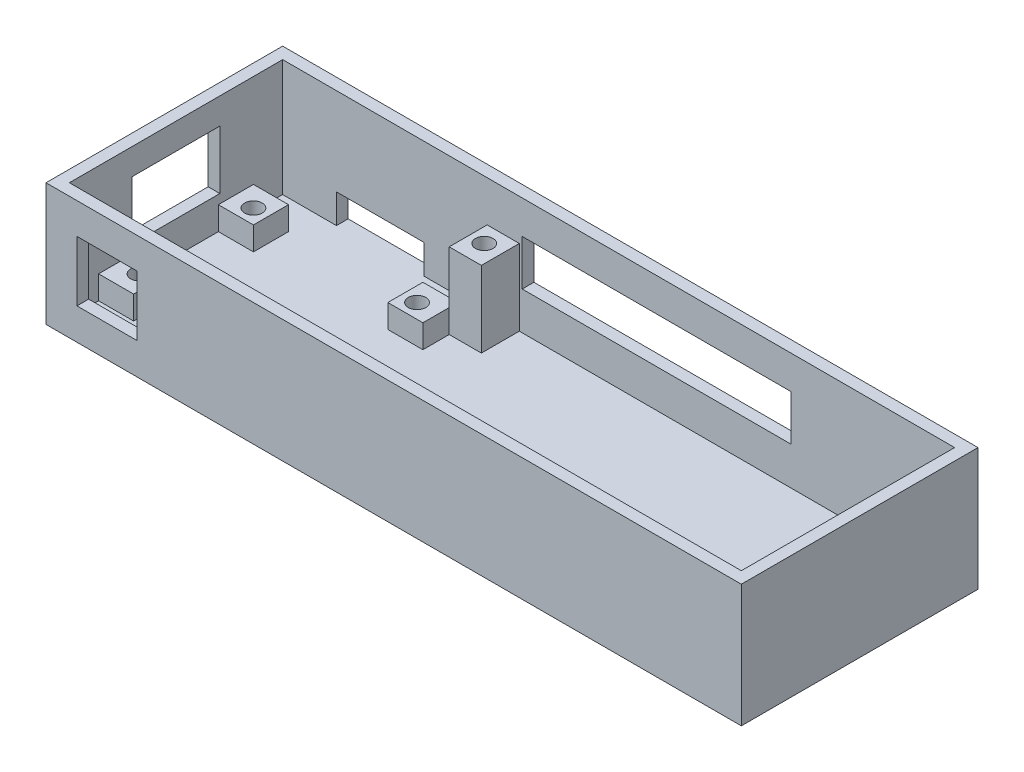
from build123d import *

# Parameters (mm, degrees)
SKETCH1_W                = 115
SKETCH1_H                = 36.5
BOSS_EXTRUDE1_DEPTH      = 1
BOSS_EXTRUDE2_DEPTH      = 20
BOSS_EXTRUDE2_DEPTH_BACK = 1
SKETCH2_W                = 119
SKETCH2_H                = 40.5
SKETCH2_W_2              = 115
SKETCH2_H_2              = 36.5
SKETCH3_R                = 1.5
SKETCH3_W                = 6
SKETCH3_H                = 6
BOSS_EXTRUDE3_DEPTH      = 4
SKETCH4_R                = 1.5
SKETCH4_W                = 5.5
SKETCH4_H                = 6.495155074
BOSS_EXTRUDE4_DEPTH      = 13
SKETCH5_W                = 15
SKETCH5_H                = 10
CUT_EXTRUDE1_DEPTH       = 8
SKETCH6_W                = 46
SKETCH6_H                = 7.792677535
CUT_EXTRUDE2_DEPTH       = 8
SKETCH7_W                = 10.3
SKETCH7_H                = 10.3
CUT_EXTRUDE3_DEPTH       = 8
SKETCH8_W                = 15
SKETCH8_H                = 5
CUT_EXTRUDE4_DEPTH       = 8
SKETCH9_W                = 119
SKETCH9_H                = 40.5
SKETCH9_W_2              = 17
SKETCH9_H_2              = 17
SKETCH9_W_3              = 73
SKETCH9_H_3              = 26
BOSS_EXTRUDE5_DEPTH      = 3
CUT_EXTRUDE5_DEPTH       = 10
CUT_EXTRUDE5_DEPTH_BACK  = 10
SKETCH10_R               = 1.5


with BuildPart() as part:
    # Sketch1 → Boss-Extrude1 (new body)
    with BuildSketch(Plane(origin=(0, 0, 0), x_dir=(1, 0, 0), z_dir=(0, 1, 0))):
        Rectangle(SKETCH1_W, SKETCH1_H)
    extrude(amount=BOSS_EXTRUDE1_DEPTH)


with BuildPart() as body_2:
    # Sketch2 → Boss-Extrude2 (new, two sides: drawn at the far end of the back side and taken through both)
    with BuildSketch(Plane(origin=(0, 1, 0), x_dir=(1, 0, 0), z_dir=(0, 1, 0)).offset(-BOSS_EXTRUDE2_DEPTH_BACK)):
        Rectangle(SKETCH2_W, SKETCH2_H)
        Rectangle(SKETCH2_W_2, SKETCH2_H_2, mode=Mode.SUBTRACT)
    extrude(amount=BOSS_EXTRUDE2_DEPTH + BOSS_EXTRUDE2_DEPTH_BACK)

    # Intersect1: read off the stored shape, not the designer's step
    # Intersect1: union part
    add(part.part)

    # Sketch3 → Boss-Extrude3 (add)
    # profile 1 of 4: a face of its own
    with BuildSketch(Plane(origin=(0, 1, 0), x_dir=(1, 0, 0), z_dir=(0, 1, 0))):
        Polygon((-51.5, 7.25), (-51.5, 13.25), (-54, 13.25), (-57.5, 13.25), (-57.5, 9.75), (-57.5, 7.25), align=None)
        with Locations(Location((-54, 9.75, 0), (0, 0, 270))):
            Circle(SKETCH3_R, mode=Mode.SUBTRACT)
    # profile 2 of 4: a face of its own
    with BuildSketch(Plane(origin=(0, 1, 0), x_dir=(1, 0, 0), z_dir=(0, 1, 0))):
        with Locations((-25.5, 10.25)):
            Rectangle(SKETCH3_W, SKETCH3_H)
        with Locations(Location((-26, 9.75, 0), (0, 0, 90))):
            Circle(SKETCH3_R, mode=Mode.SUBTRACT)
    # profile 3 of 4: a face of its own
    with BuildSketch(Plane(origin=(0, 1, 0), x_dir=(1, 0, 0), z_dir=(0, 1, 0))):
        with Locations((-25.5, -10.25)):
            Rectangle(SKETCH3_W, SKETCH3_H)
        with Locations(Location((-26, -9.75, 0), (0, 0, 270))):
            Circle(SKETCH3_R, mode=Mode.SUBTRACT)
    # profile 4 of 4: a face of its own
    with BuildSketch(Plane(origin=(0, 1, 0), x_dir=(1, 0, 0), z_dir=(0, 1, 0))):
        with Locations((-54.5, -10.25)):
            Rectangle(SKETCH3_W, SKETCH3_H)
        with Locations(Location((-54, -9.75, 0), (0, 0, 90))):
            Circle(SKETCH3_R, mode=Mode.SUBTRACT)
    extrude(amount=BOSS_EXTRUDE3_DEPTH)

    # Sketch4 → Boss-Extrude4 (add)
    # profile 1 of 4: a face of its own
    with BuildSketch(Plane(origin=(0, 1, 0), x_dir=(1, 0, 0), z_dir=(0, 1, 0))):
        Polygon((-22.5, 13.25), (-22.5, 11.754844926), (-17, 11.754844926), (-17, 18.25), (-20, 18.25), (-22.5, 18.25), (-22.5, 15.25), align=None)
        with Locations(Location((-20, 15.25, 0), (0, 0, 90))):
            Circle(SKETCH4_R, mode=Mode.SUBTRACT)
    # profile 2 of 4: a face of its own
    with BuildSketch(Plane(origin=(0, 1, 0), x_dir=(1, 0, 0), z_dir=(0, 1, 0))):
        with Locations((-19.75, -15.002422463)):
            Rectangle(SKETCH4_W, SKETCH4_H)
        with Locations(Location((-20, -15.25, 0), (0, 0, 90))):
            Circle(SKETCH4_R, mode=Mode.SUBTRACT)
    # profile 3 of 4: a face of its own
    with BuildSketch(Plane(origin=(0, 1, 0), x_dir=(1, 0, 0), z_dir=(0, 1, 0))):
        with Locations((54.75, -15.002422463)):
            Rectangle(SKETCH4_W, SKETCH4_H)
        with Locations(Location((55, -15.25, 0), (0, 0, 90))):
            Circle(SKETCH4_R, mode=Mode.SUBTRACT)
    # profile 4 of 4: a face of its own
    with BuildSketch(Plane(origin=(0, 1, 0), x_dir=(1, 0, 0), z_dir=(0, 1, 0))):
        with Locations((54.75, 15.002422463)):
            Rectangle(SKETCH4_W, SKETCH4_H)
        with Locations(Location((55, 15.25, 0), (0, 0, 90))):
            Circle(SKETCH4_R, mode=Mode.SUBTRACT)
    extrude(amount=BOSS_EXTRUDE4_DEPTH)

    # Sketch5 → Cut-Extrude1 (cut)
    with BuildSketch(Plane.ZY.offset(59.5)):
        with Locations((0, 11.525411997)):
            Rectangle(SKETCH5_W, SKETCH5_H)
    extrude(amount=-CUT_EXTRUDE1_DEPTH, mode=Mode.SUBTRACT)

    # Sketch6 → Cut-Extrude2 (cut)
    with BuildSketch(Plane(origin=(0, 0, -20.25), x_dir=(-1, 0, 0), z_dir=(0, 0, -1))):
        with Locations((-6.5, 11.396338768)):
            Rectangle(SKETCH6_W, SKETCH6_H)
    extrude(amount=-CUT_EXTRUDE2_DEPTH, mode=Mode.SUBTRACT)

    # Sketch7 → Cut-Extrude3 (cut)
    with BuildSketch(Plane.XY.offset(20.25)):
        with Locations((-49.05, 10.55)):
            Rectangle(SKETCH7_W, SKETCH7_H)
    extrude(amount=-CUT_EXTRUDE3_DEPTH, mode=Mode.SUBTRACT)

    # Sketch8 → Cut-Extrude4 (cut)
    with BuildSketch(Plane(origin=(0, 0, -20.25), x_dir=(-1, 0, 0), z_dir=(0, 0, -1))):
        with Locations((40.794043984, 3.5)):
            Rectangle(SKETCH8_W, SKETCH8_H)
    extrude(amount=-CUT_EXTRUDE4_DEPTH, mode=Mode.SUBTRACT)

    # Sketch10 → Cut-Extrude5 (cut, two sides: drawn at the far end of the back side and taken through both)
    with BuildSketch(Plane(origin=(0, 1, 0), x_dir=(1, 0, 0), z_dir=(0, 1, 0)).offset(-CUT_EXTRUDE5_DEPTH_BACK)):
        with Locations(Location((55, 15.25, 0), (0, 0, 90))):
            Circle(SKETCH10_R)
        with Locations(Location((55, -15.25, 0), (0, 0, 90))):
            Circle(SKETCH10_R)
        with Locations(Location((-54, -9.75, 0), (0, 0, 90))):
            Circle(SKETCH10_R)
        with Locations(Location((-20, -15.25, 0), (0, 0, 90))):
            Circle(SKETCH10_R)
        with Locations(Location((-26, -9.75, 0), (0, 0, 90))):
            Circle(SKETCH10_R)
        with Locations(Location((-20, 15.25, 0), (0, 0, 90))):
            Circle(SKETCH10_R)
        with Locations(Location((-26, 9.75, 0), (0, 0, 90))):
            Circle(SKETCH10_R)
        with Locations(Location((-54, 9.75, 0), (0, 0, 90))):
            Circle(SKETCH10_R)
    extrude(amount=CUT_EXTRUDE5_DEPTH + CUT_EXTRUDE5_DEPTH_BACK, mode=Mode.SUBTRACT)


with BuildPart() as body_2_2:
    # Sketch9 → Boss-Extrude5 (new body)
    with BuildSketch(Plane(origin=(0, 21, 0), x_dir=(1, 0, 0), z_dir=(0, 1, 0))):
        Rectangle(SKETCH9_W, SKETCH9_H)
        with Locations((-40, 1.75)):
            Rectangle(SKETCH9_W_2, SKETCH9_H_2, mode=Mode.SUBTRACT)
        with Locations((17.25, -0.25)):
            Rectangle(SKETCH9_W_3, SKETCH9_H_3, mode=Mode.SUBTRACT)
    extrude(amount=BOSS_EXTRUDE5_DEPTH)


solid = body_2.part
